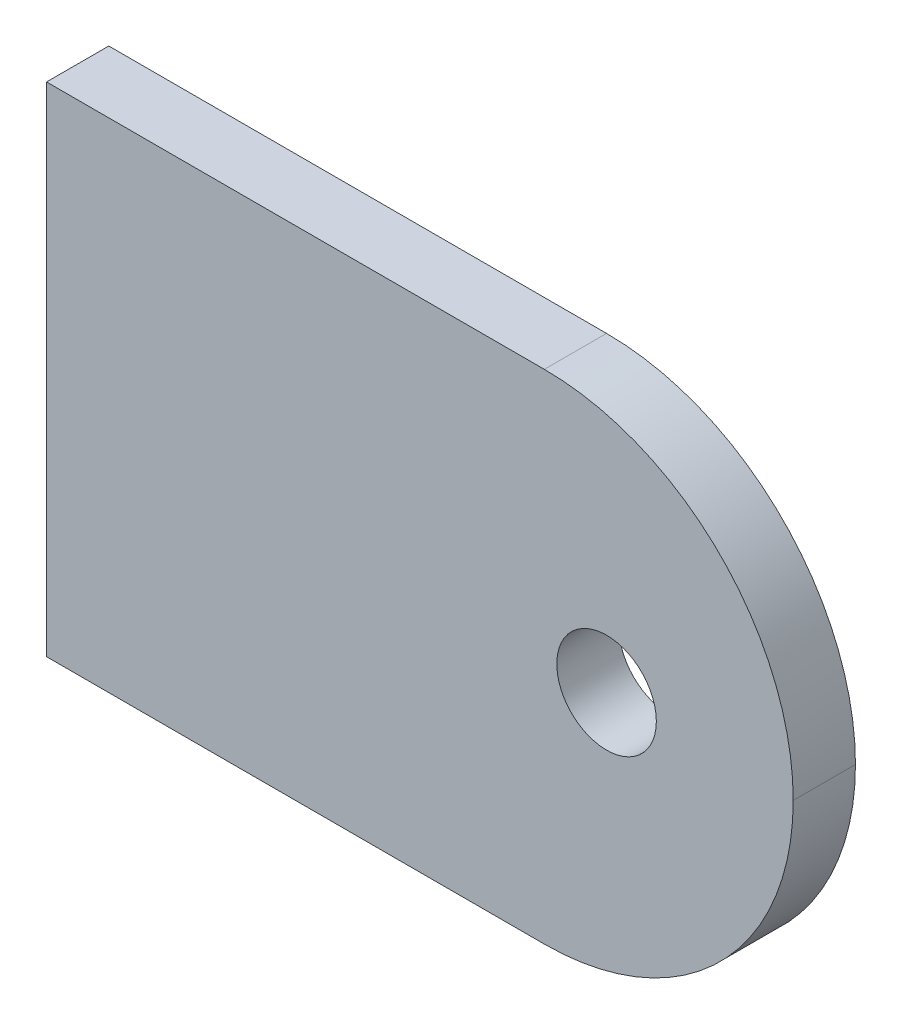
from build123d import *

# Parameters (mm, degrees)
SKETCH1_W           = 38.1
SKETCH1_H           = 25.4
BOSS_EXTRUDE1_DEPTH = 3.175
FILLET1_R           = 12.7
SKETCH2_R           = 2.54
CUT_EXTRUDE1_DEPTH  = 46.900442536


with BuildPart() as part:
    # Sketch1 → Boss-Extrude1 (new body)
    with BuildSketch(Plane.XY):
        with Locations((19.05, 12.7)):
            Rectangle(SKETCH1_W, SKETCH1_H)
    extrude(amount=BOSS_EXTRUDE1_DEPTH)

    # Fillet1
    fillet1_edges = [part.edges().sort_by_distance(p)[0] for p in [
        (38.1, 0, 1.5875),
        (38.1, 25.4, 1.5875),
    ]]
    fillet(fillet1_edges, radius=FILLET1_R - 0.0001)  # a hair under: the kernel refuses the full size

    # Sketch2 → Cut-Extrude1 (cut, through all)
    with BuildSketch(Plane.XY.offset(3.175)):
        with Locations((28.575, 12.7)):
            Circle(SKETCH2_R)
    extrude(amount=-CUT_EXTRUDE1_DEPTH, mode=Mode.SUBTRACT)


solid = part.part
